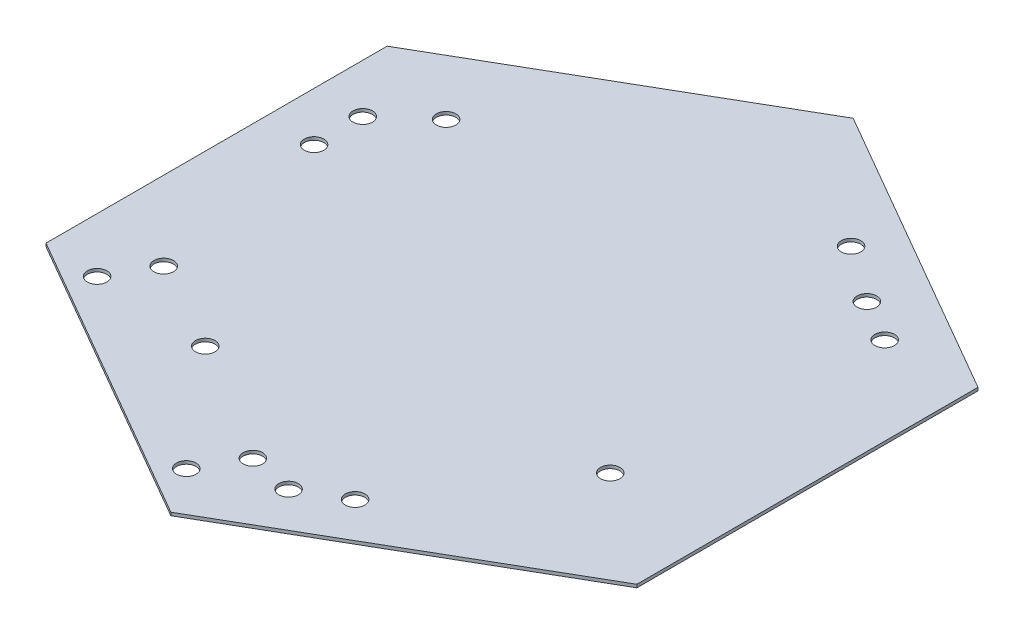
from build123d import *

# Parameters (mm, degrees)
SKETCH1_R           = 2.54
BOSS_EXTRUDE1_DEPTH = 0.8128
SKETCH2_R           = 2.54
CUT_EXTRUDE1_DEPTH  = 118.606454516
SKETCH3_R           = 2.54
CUT_EXTRUDE2_DEPTH  = 118.606454516


with BuildPart() as part:
    # Sketch1 → Boss-Extrude1 (new body)
    with BuildSketch(Plane(origin=(0, 0, 0), x_dir=(1, 0, 0), z_dir=(0, 1, 0))):
        Polygon((0, 88.9), (-76.989658396, 44.45), (-76.989658396, -44.45), (0, -88.9), (76.989658396, -44.45), (76.989658396, 44.45), align=None)
        with Locations((10.147783942, -68.376477372)):
            Circle(SKETCH1_R, mode=Mode.SUBTRACT)
        with Locations((21.14630657, -62.026477372)):
            Circle(SKETCH1_R, mode=Mode.SUBTRACT)
        with Locations((-64.289658396, 25.4)):
            Circle(SKETCH1_R, mode=Mode.SUBTRACT)
        with Locations((-64.289658396, 12.7)):
            Circle(SKETCH1_R, mode=Mode.SUBTRACT)
        with Locations((54.141874454, 42.976477372)):
            Circle(SKETCH1_R, mode=Mode.SUBTRACT)
        with Locations((43.143351826, 49.326477372)):
            Circle(SKETCH1_R, mode=Mode.SUBTRACT)
    extrude(amount=BOSS_EXTRUDE1_DEPTH)

    # Sketch2 → Cut-Extrude1 (cut, through all)
    with BuildSketch(Plane(origin=(0, 0.8128, 0), x_dir=(1, 0, 0), z_dir=(0, 1, 0))):
        with Locations((28.620590949, 59.732317666)):
            Circle(SKETCH2_R)
        with Locations((48.416295038, -22.82051708)):
            Circle(SKETCH2_R)
        with Locations((-52.77011314, 35.59948292)):
            Circle(SKETCH2_R)
        with Locations((-32.974409051, -46.953351826)):
            Circle(SKETCH2_R)
    extrude(amount=-CUT_EXTRUDE1_DEPTH, mode=Mode.SUBTRACT)

    # Sketch3 → Cut-Extrude2 (cut, through all)
    with BuildSketch(Plane(origin=(0, 0.8128, 0), x_dir=(1, 0, 0), z_dir=(0, 1, 0))):
        with Locations((-7.823522628, -77.050738686)):
            Circle(SKETCH3_R)
        with Locations((-62.816135768, -45.300738686)):
            Circle(SKETCH3_R)
        with Locations((-56.466135768, -34.302216058)):
            Circle(SKETCH3_R)
        with Locations((-1.473522628, -66.052216058)):
            Circle(SKETCH3_R)
    extrude(amount=-CUT_EXTRUDE2_DEPTH, mode=Mode.SUBTRACT)


solid = part.part
